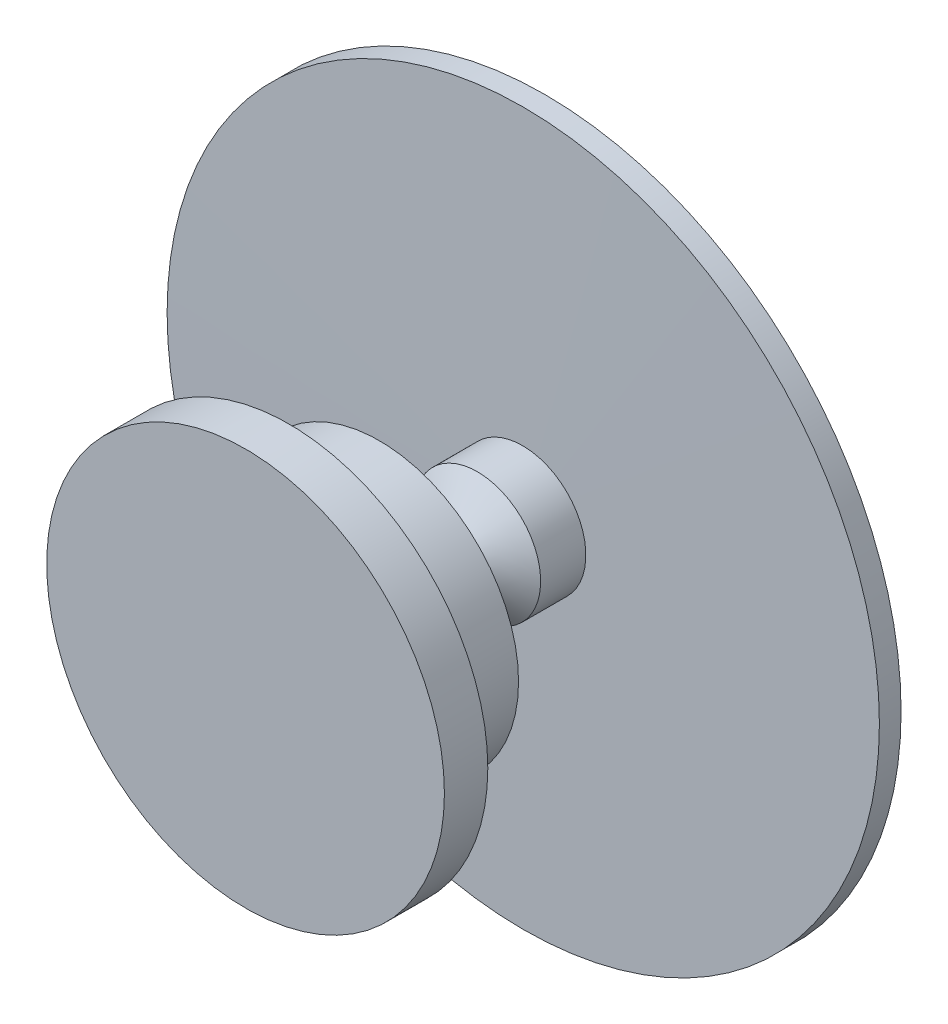
from build123d import *

# Parameters (mm, degrees)
SKETCH_14_W = 110
SKETCH_14_H = 12


with BuildPart() as part:
    # Эскиз14 → Повернуть11 (revolve)
    with BuildSketch(Plane(origin=(0, 0, 0), x_dir=(1, 0, 0), z_dir=(0, 1, 0))):
        with Locations((-55, -447)):
            Rectangle(SKETCH_14_W, SKETCH_14_H)
    revolve(axis=Axis((0, 0, 600), (0, 0, -1)))

    # Эскиз15 → Повернуть12 (revolve)
    with BuildSketch(Plane(origin=(0, 0, 0), x_dir=(1, 0, 0), z_dir=(0, 1, 0))):
        Polygon((-110, -441), (-110, -429), (-77, -429), (-77, -379), (-15, -379), (-15, -381), (-75, -381), (-75, -441), align=None)
    revolve(axis=Axis((0, 0, 0), (0, 0, 1)))

    # Эскиз16 → Повернуть17 (revolve)
    with BuildSketch(Plane(origin=(0, 0, 0), x_dir=(1, 0, 0), z_dir=(0, 1, 0))):
        Polygon((-15, -381), (-13, -381), (-13, -332.5), (-11.5, -332.5), (-11.5, -304.5), (-18.2, -304.5), (-17.3, -307.5), (-15.7, -307.5), (-15, -305.5), (-13, -305.5), (-13, -331), (-15, -331), align=None)
    revolve(axis=Axis((0, 0, 0), (0, 0, 1)))

    # Эскиз17 → Повернуть19 (revolve)
    with BuildSketch(Plane(origin=(0, 0, 0), x_dir=(1, 0, 0), z_dir=(0, 1, 0))):
        Polygon((-16.5, -341), (-15, -341), (-15, -336.62), (-33.5, -323.4), (-33.5, -283.4), (-159.5, -283.4), (-159.5, -287.4), (-197, -287.4), (-197, -299.4), (-35, -299.78), (-35, -324.78), (-16.5, -338), align=None)
    revolve(axis=Axis((0, 0, 0), (0, 0, 1)))


solid = part.part
